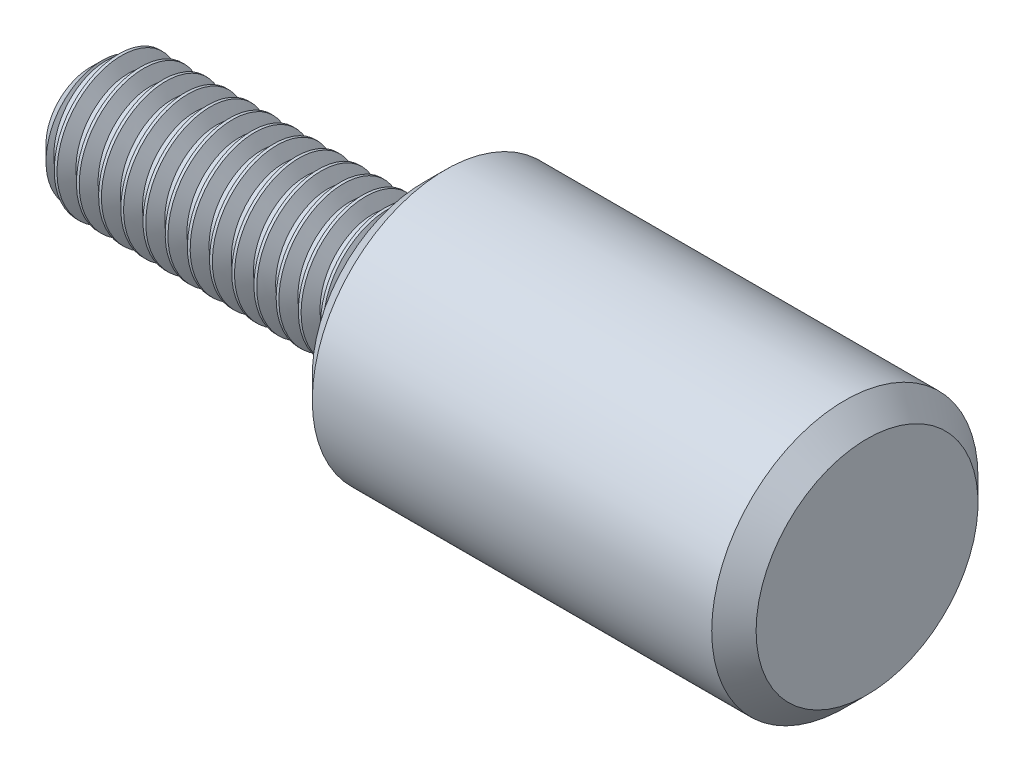
from build123d import *

# Parameters (mm, degrees)
CHAMFER1_SIZE = 1
CHAMFER2_SIZE = 1
THREAD1_PITCH = 1
THREAD1_TO    = 16


with BuildPart() as part:
    # Sketch1 → Revolve1 (revolve)
    with BuildSketch(Plane.XY, mode=Mode.PRIVATE) as revolve1_sk:
        Polygon((0, 3), (15, 3), (15, 6), (35, 6), (35, 0), (0, 0), align=None)
    revolve(revolve1_sk.sketch.rotate(Axis((0, 0, 0), (1, 0, 0)), 90), axis=Axis((0, 0, 0), (1, 0, 0)))

    # Chamfer1
    chamfer1_edges = [part.edges().sort_by_distance(p)[0] for p in [
        (35, 0, -6),
        (15, 0, -6),
    ]]
    chamfer(chamfer1_edges, length=CHAMFER1_SIZE)

    # Chamfer2
    chamfer2_edges = [part.edges().sort_by_distance(p)[0] for p in [
        (0, 0, -3),
    ]]
    chamfer(chamfer2_edges, length=CHAMFER2_SIZE)

    # Thread1: arcs per turn and ends read off the stored shape
    # Thread1: the profile of Thread Profile1 profile screwed along a right-hand helix through 16 turns, 8 arcs to a turn; built about Z, then put on its axis
    thread1_z = Axis((0, 0, 0), (0, 0, 1))
    thread1_corners = [(3.0003, 0, -0.000173205), (3.0003, 0, 0.875173202), (2.458734125, 0, 0.562499999), (2.458734125, 0, 0.312499999)]
    with BuildLine(mode=Mode.PRIVATE) as thread1_profile:
        Line(thread1_corners[0], thread1_corners[1])
        Line(thread1_corners[1], thread1_corners[2])
        Line(thread1_corners[2], thread1_corners[3])
        Line(thread1_corners[3], thread1_corners[0])
    thread1_cap = Face(thread1_profile.wire())
    thread1_turn_angles = [0, 22.5, 45, 67.5, 90, 112.5, 135, 157.5, 180, 202.5, 225, 247.5, 270, 292.5, 315, 337.5, 360]
    thread1_turn_weights = [1, 0.9238795325112867, 1, 0.9238795325112867, 1, 0.9238795325112867, 1, 0.9238795325112867, 1, 0.9238795325112867, 1, 0.9238795325112867, 1, 0.9238795325112867, 1, 0.9238795325112867, 1]
    thread1_turn_rails = [Edge.make_bspline([Vector(p[0], p[1], 0).rotate(thread1_z, thread1_turn_angles[k]) / thread1_turn_weights[k] + Vector(0, 0, p[2] + THREAD1_PITCH * thread1_turn_angles[k] / 360) for k in range(17)], [0, 0, 0, 1, 1, 2, 2, 3, 3, 4, 4, 5, 5, 6, 6, 7, 7, 8, 8, 8], 2, thread1_turn_weights) for p in thread1_corners]
    thread1_turn_sides = [Face.make_surface_from_curves(thread1_turn_rails[p[0]], thread1_turn_rails[p[1]]) for p in [(0, 1), (1, 2), (2, 3), (3, 0)]]
    thread1 = Plane(origin=(-1, 0, 0), x_dir=(0, 0, -1), z_dir=(1, 0, 0)) * split(Solid(Shell([*[p.moved(Location((0, 0, THREAD1_PITCH * i))) for i in range(16) for p in thread1_turn_sides], thread1_cap, thread1_cap.rotate(thread1_z, 5760).moved(Location((0, 0, THREAD1_PITCH * 5760 / 360)))])), bisect_by=Plane.XY.offset(THREAD1_TO), keep=Keep.BOTTOM, mode=Mode.PRIVATE)
    add(thread1, mode=Mode.SUBTRACT)


solid = part.part
